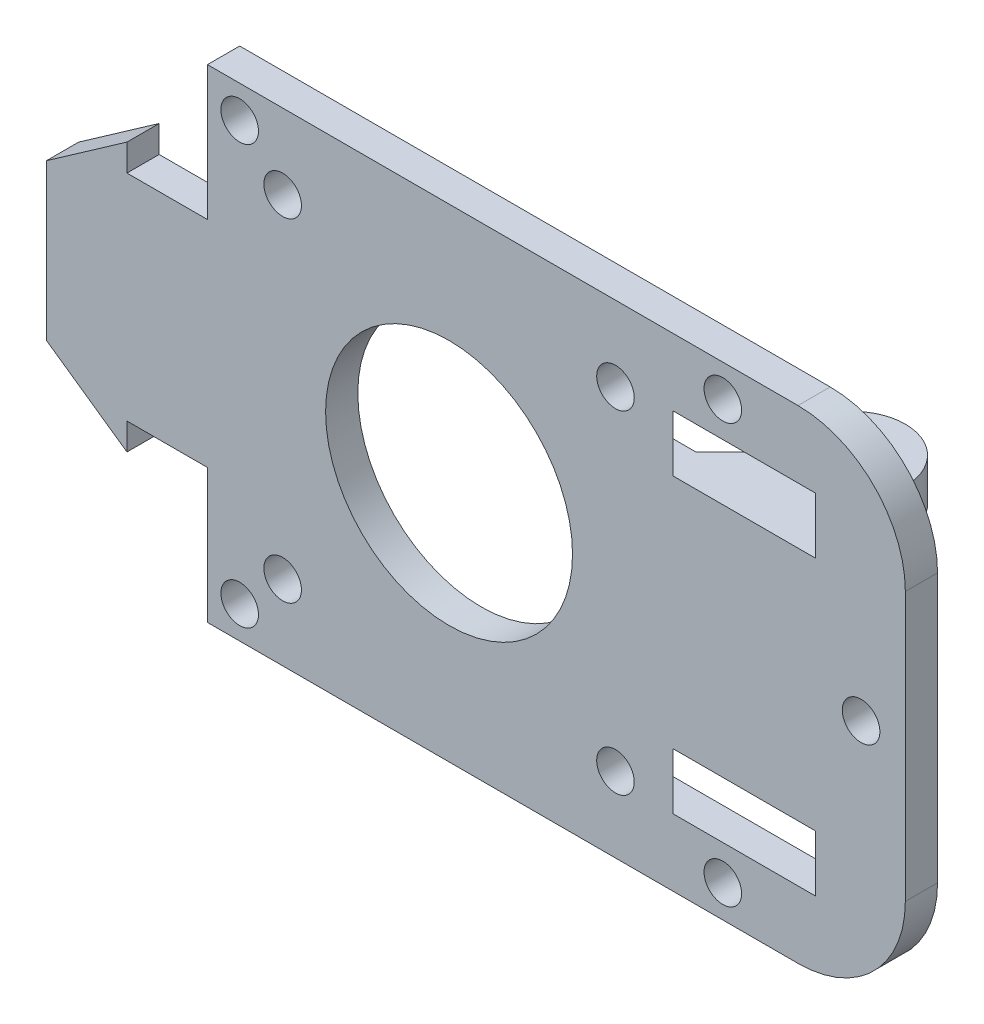
from build123d import *

# Parameters (mm, degrees)
SKETCH1_W           = 65
SKETCH1_H           = 45
BOSS_EXTRUDE1_DEPTH = 3
FILLET4_R           = 10
BOSS_EXTRUDE4_DEPTH = 3
SKETCH9_R           = 1.75
CUT_EXTRUDE5_DEPTH  = 5
SKETCH10_R          = 1.75
SKETCH10_R_2        = 11.5
CUT_EXTRUDE6_DEPTH  = 5
SKETCH2_W           = 10
SKETCH2_H           = 4
BOSS_EXTRUDE5_DEPTH = 12
SKETCH11_R          = 1.75
CUT_EXTRUDE7_DEPTH  = 22
CHAMFER3_SIZE       = 2.5
CHAMFER4_SIZE       = 5
FILLET5_R           = 5
SKETCH13_W          = 12
SKETCH13_H          = 5.25


with BuildPart() as part:
    # Sketch1 → Boss-Extrude1 (new body)
    with BuildSketch(Plane.XY):
        with Locations((-11.936997319, -3.156836461)):
            Rectangle(SKETCH1_W, SKETCH1_H)
    extrude(amount=BOSS_EXTRUDE1_DEPTH)

    # Fillet4
    fillet4_edges = [part.edges().sort_by_distance(p)[0] for p in [
        (20.563002681, 19.343163539, 1.5),
        (20.563002681, -25.656836461, 1.5),
    ]]
    fillet(fillet4_edges, radius=FILLET4_R)

    # Sketch8 → Boss-Extrude4 (add)
    with BuildSketch(Plane(origin=(0, 0, 0), x_dir=(-1, 0, 0), z_dir=(0, 0, -1))):
        Polygon((44.436997319, 6.843163539), (51.936997319, 6.843163539), (51.936997319, 9.343163539), (59.436997319, 4.091607002), (59.436997319, -10.405279925), (51.936997319, -15.656836461), (51.936997319, -13.156836461), (44.436997319, -13.156836461), align=None)
    extrude(amount=-BOSS_EXTRUDE4_DEPTH)

    # Sketch9 → Cut-Extrude5 (cut)
    with BuildSketch(Plane(origin=(0, 0, 0), x_dir=(-1, 0, 0), z_dir=(0, 0, -1))):
        with Locations((-16.440039295, -3.156836461)):
            Circle(SKETCH9_R)
        with Locations((-3.563002681, -22.656836461)):
            Circle(SKETCH9_R)
        with Locations((41.436997319, -22.656836461)):
            Circle(SKETCH9_R)
        with Locations(Location((41.436997319, 16.343163539, 0), (0, 0, 180))):
            Circle(SKETCH9_R)
        with Locations(Location((-3.563002681, 16.343163539, 0), (0, 0, 180))):
            Circle(SKETCH9_R)
    extrude(amount=-CUT_EXTRUDE5_DEPTH, mode=Mode.SUBTRACT)

    # Sketch10 → Cut-Extrude6 (cut)
    with BuildSketch(Plane(origin=(0, 0, 0), x_dir=(-1, 0, 0), z_dir=(0, 0, -1))):
        with Locations((6.436997319, -18.656836461)):
            Circle(SKETCH10_R)
        with Locations((37.436997319, 12.343163539)):
            Circle(SKETCH10_R)
        with Locations((6.436997319, 12.343163539)):
            Circle(SKETCH10_R)
        with Locations((37.436997319, -18.656836461)):
            Circle(SKETCH10_R)
        with Locations((21.936997319, -3.156836461)):
            Circle(SKETCH10_R_2)
    extrude(amount=-CUT_EXTRUDE6_DEPTH, mode=Mode.SUBTRACT)

    # Sketch2 → Boss-Extrude5 (add)
    with BuildSketch(Plane(origin=(0, 0, 0), x_dir=(-1, 0, 0), z_dir=(0, 0, -1))):
        with Locations((-5.563002681, 5.843163539)):
            Rectangle(SKETCH2_W, SKETCH2_H)
        with Locations((-5.563002681, -12.156836461)):
            Rectangle(SKETCH2_W, SKETCH2_H)
    extrude(amount=BOSS_EXTRUDE5_DEPTH)

    # Sketch11 → Cut-Extrude7 (cut)
    with BuildSketch(Plane.XZ.offset(14.156836461)):
        with Locations(Location((5.563002681, -7, 0), (0, 0, 270))):
            Circle(SKETCH11_R)
    extrude(amount=-CUT_EXTRUDE7_DEPTH, mode=Mode.SUBTRACT)

    # Chamfer3
    chamfer3_edges = [part.edges().sort_by_distance(p)[0] for p in [
        (10.563002681, -12.156836461, 0),
        (0.563002681, -12.156836461, 0),
        (0.563002681, 5.843163539, 0),
        (10.563002681, 5.843163539, 0),
    ]]
    chamfer(chamfer3_edges, length=CHAMFER3_SIZE)

    # Chamfer4
    chamfer4_edges = [part.edges().sort_by_distance(p)[0] for p in [
        (5.563002681, -10.156836461, 0),
        (5.563002681, 3.843163539, 0),
    ]]
    chamfer(chamfer4_edges, length=CHAMFER4_SIZE)

    # Fillet5
    fillet5_edges = [part.edges().sort_by_distance(p)[0] for p in [
        (0.563002681, -12.156836461, -12),
        (10.563002681, -12.156836461, -12),
        (0.563002681, 5.843163539, -12),
        (10.563002681, 5.843163539, -12),
    ]]
    fillet(fillet5_edges, radius=FILLET5_R - 0.0001)  # a hair under: the kernel refuses the full size

    # Sketch13 → Cut-Revolve1 (revolve, cut)
    with BuildSketch(Plane(origin=(5.563002681, 0, 0), x_dir=(0, 0, -1), z_dir=(1, 0, 0))):
        with Locations((13, 10.468163539)):
            Rectangle(SKETCH13_W, SKETCH13_H)
    cut_revolve1 = revolve(axis=Axis((5.563002681, 7.843163539, -7), (0, -1, 0)), mode=Mode.SUBTRACT)

    # Mirror1: Cut-Revolve1 across plane
    add(cut_revolve1.mirror(Plane.ZX.offset(-3.156836461)), mode=Mode.SUBTRACT)


solid = part.part
